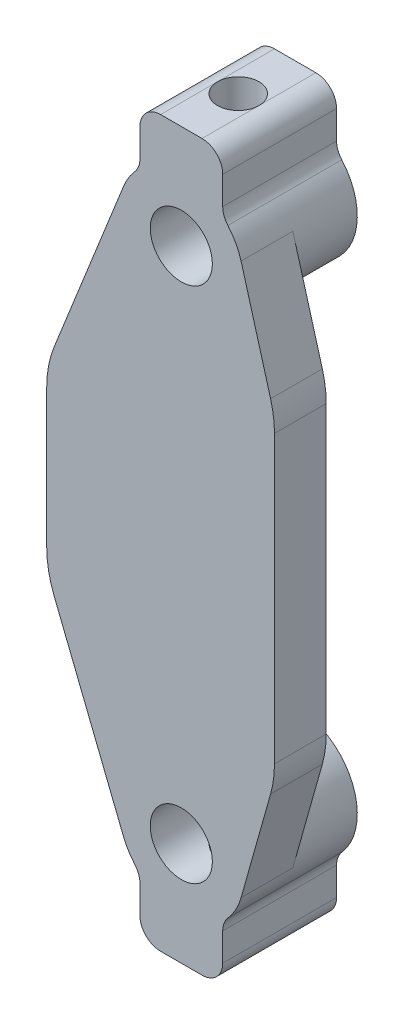
from build123d import *

# Parameters (mm, degrees)
SKETCH1_R           = 3
BOSS_EXTRUDE1_DEPTH = 5
BOSS_EXTRUDE2_START = -6
SKETCH1_8_R         = 3
BOSS_EXTRUDE2_DEPTH = 6
FILLET1_R           = 2
CUT_EXTRUDE1_REACH  = 73.449
CUT_EXTRUDE2_REACH  = 143.449
CUT_EXTRUDE2_START  = -70


with BuildPart() as part:
    # Sketch1 → Boss-Extrude1 (new body)
    with BuildSketch(Plane.XY):
        with BuildLine():
            Line((8.623745493, 16.538277732), (5.774247296, 26.630358295))
            ThreePointArc((5.774247296, 26.630358295), (5.089489426, 28.177593017), (4, 29.472135955))
            Line((4, 29.472135955), (4, 35))
            Line((4, 35), (-4, 35))
            Line((-4, 35), (-4, 29.472135955))
            ThreePointArc((-4, 29.472135955), (-4.915940504, 28.439989675), (-5.571845104, 27.225880081))
            Line((-5.571845104, 27.225880081), (-12.286408507, 10.417918353))
            ThreePointArc((-12.286408507, 10.417918353), (-12.819981799, 8.597021991), (-13, 6.708118217))
            Line((-13, 6.708118217), (-13, -6.708118217))
            ThreePointArc((-13, -6.708118217), (-12.819981799, -8.597021991), (-12.286408507, -10.417918353))
            Line((-12.286408507, -10.417918353), (-5.571845104, -27.225880081))
            ThreePointArc((-5.571845104, -27.225880081), (-4.915940504, -28.439989675), (-4, -29.472135955))
            Line((-4, -29.472135955), (-4, -35))
            Line((-4, -35), (4, -35))
            Line((4, -35), (4, -29.472135955))
            ThreePointArc((4, -29.472135955), (5.089489426, -28.177593017), (5.774247296, -26.630358295))
            Line((5.774247296, -26.630358295), (8.623745493, -16.538277732))
            ThreePointArc((8.623745493, -16.538277732), (8.905489764, -15.192608796), (9, -13.821013908))
            Line((9, -13.821013908), (9, 13.821013908))
            ThreePointArc((9, 13.821013908), (8.905489764, 15.192608796), (8.623745493, 16.538277732))
        make_face()
        with Locations((0, 25)):
            Circle(SKETCH1_R, mode=Mode.SUBTRACT)
        with Locations((0, -25)):
            Circle(SKETCH1_R, mode=Mode.SUBTRACT)
    extrude(amount=BOSS_EXTRUDE1_DEPTH)

    # Sketch1<8> → Boss-Extrude2 (add)
    # profile 1 of 2: a face of its own
    with BuildSketch(Plane.XY.offset(BOSS_EXTRUDE2_START)):
        with BuildLine():
            ThreePointArc((-4, 29.472135955), (0, 19), (4, 29.472135955))
            Line((4, 29.472135955), (4, 35))
            Line((4, 35), (-4, 35))
            Line((-4, 35), (-4, 29.472135955))
        make_face()
        with Locations((0, 25)):
            Circle(SKETCH1_8_R, mode=Mode.SUBTRACT)
    # profile 2 of 2: a face of its own
    with BuildSketch(Plane.XY.offset(BOSS_EXTRUDE2_START)):
        with BuildLine():
            ThreePointArc((4, -29.472135955), (0, -19), (-4, -29.472135955))
            Line((-4, -29.472135955), (-4, -35))
            Line((-4, -35), (4, -35))
            Line((4, -35), (4, -29.472135955))
        make_face()
        with Locations((0, -25)):
            Circle(SKETCH1_8_R, mode=Mode.SUBTRACT)
    extrude(amount=BOSS_EXTRUDE2_DEPTH)

    # Fillet1
    fillet1_edges = [part.edges().sort_by_distance(p)[0] for p in [
        (-4, 35, -0.5),
        (-4, 29.472135955, -0.5),
        (4, 35, -0.5),
        (4, 29.472135955, -3),
        (4, -29.472135955, -0.5),
        (4, -35, -0.5),
        (-4, -35, -0.5),
        (-4, -29.472135955, -3),
    ]]
    fillet(fillet1_edges, radius=FILLET1_R)

    # Sketch2 → Cut-Extrude1 (cut, up to next)
    with BuildSketch(Plane.XZ.offset(35), mode=Mode.PRIVATE) as cut_extrude1_sk1:
        with BuildLine():
            ThreePointArc((-2, -0.5), (0, -2.5), (2, -0.5))
            ThreePointArc((2, -0.5), (0, 1.5), (-2, -0.5))
        make_face()
    cut_extrude1_tool1 = extrude(cut_extrude1_sk1.sketch, amount=-CUT_EXTRUDE1_REACH, mode=Mode.PRIVATE) & part.part
    add(cut_extrude1_tool1.solids().sort_by_distance((0, -35, -0.5))[0], mode=Mode.SUBTRACT)

    # Sketch2<3> → Cut-Extrude2 (cut, up to next)
    with BuildSketch(Plane.XZ.offset(35).offset(CUT_EXTRUDE2_START), mode=Mode.PRIVATE) as cut_extrude2_sk1:
        with BuildLine():
            ThreePointArc((-2, -0.5), (0, -2.5), (2, -0.5))
            ThreePointArc((2, -0.5), (0, 1.5), (-2, -0.5))
        make_face()
    cut_extrude2_tool1 = extrude(cut_extrude2_sk1.sketch, amount=CUT_EXTRUDE2_REACH, mode=Mode.PRIVATE) & part.part
    add(cut_extrude2_tool1.solids().sort_by_distance((0, 35, -0.5))[0], mode=Mode.SUBTRACT)


solid = part.part
